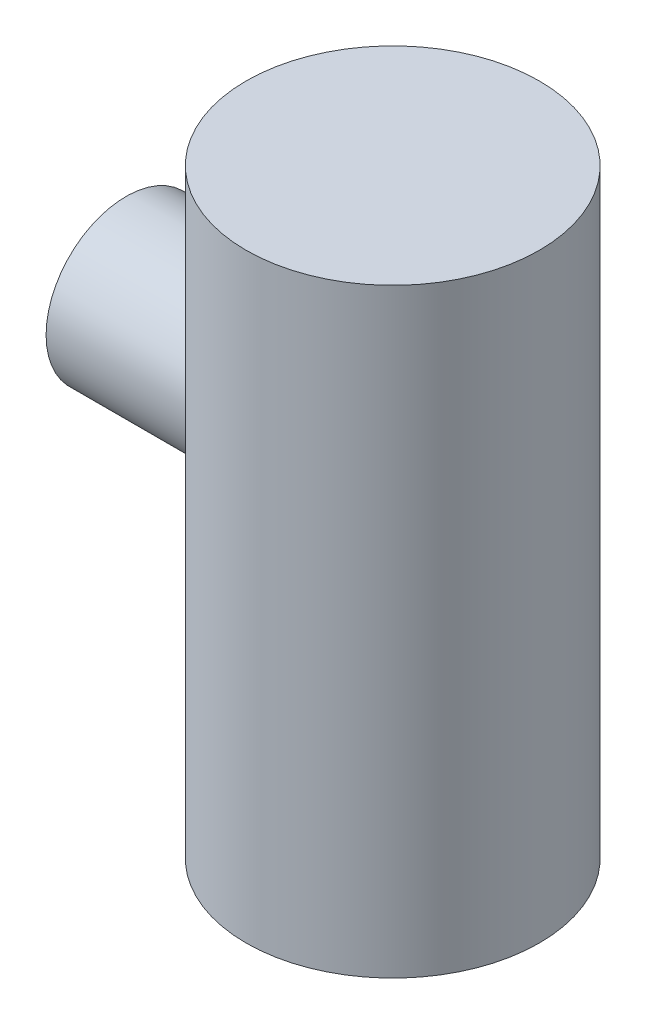
from build123d import *

# Parameters (mm, degrees)
SKETCH1_R           = 27.94
BOSS_EXTRUDE1_DEPTH = 114.3
SKETCH2_W           = 28.65102891
SKETCH2_H           = 3.175
SKETCH3_R           = 3.175
OUTLET_DEPTH        = 25.4
SKETCH4_W           = 50.8
SKETCH4_H           = 15.24


with BuildPart() as part:
    # Sketch1 → Boss-Extrude1 (new body)
    with BuildSketch(Plane(origin=(0, 0, 0), x_dir=(1, 0, 0), z_dir=(0, 1, 0))):
        Circle(SKETCH1_R)
    extrude(amount=BOSS_EXTRUDE1_DEPTH)

    # Sketch2 → inlet (revolve, cut)
    with BuildSketch(Plane.XY):
        with Locations((-29.319058082, 26.9875)):
            Rectangle(SKETCH2_W, SKETCH2_H)
    revolve(axis=Axis((-14.993543627, 25.4, 0), (-1, 0, 0)), mode=Mode.SUBTRACT)

    # Sketch3 → outlet (cut)
    with BuildSketch(Plane.XZ):
        Circle(SKETCH3_R)
    extrude(amount=-OUTLET_DEPTH, mode=Mode.SUBTRACT)

    # Sketch4 → Revolve1 (revolve)
    with BuildSketch(Plane.XY):
        with Locations((-25.4, 76.2)):
            Rectangle(SKETCH4_W, SKETCH4_H)
    revolve(axis=Axis((-50.8, 68.58, 0), (1, 0, 0)))

    # Sketch6 → 1/2 NPT Tapped Hole1 (revolve, cut)
    with BuildSketch(Plane(origin=(-50.8, 68.58, 0), x_dir=(0, 0, 1), z_dir=(0, 1, 0))):
        Polygon((0, 0), (0, 27.970543693), (8.9281, 22.606), (8.9281, 13.462), (10.280678542, 13.462), (10.6647361, 0.635), (11.2997361, 0), align=None)
    revolve(axis=Axis((-57.15, 68.58, 0), (1, 0, 0)), mode=Mode.SUBTRACT)


solid = part.part
